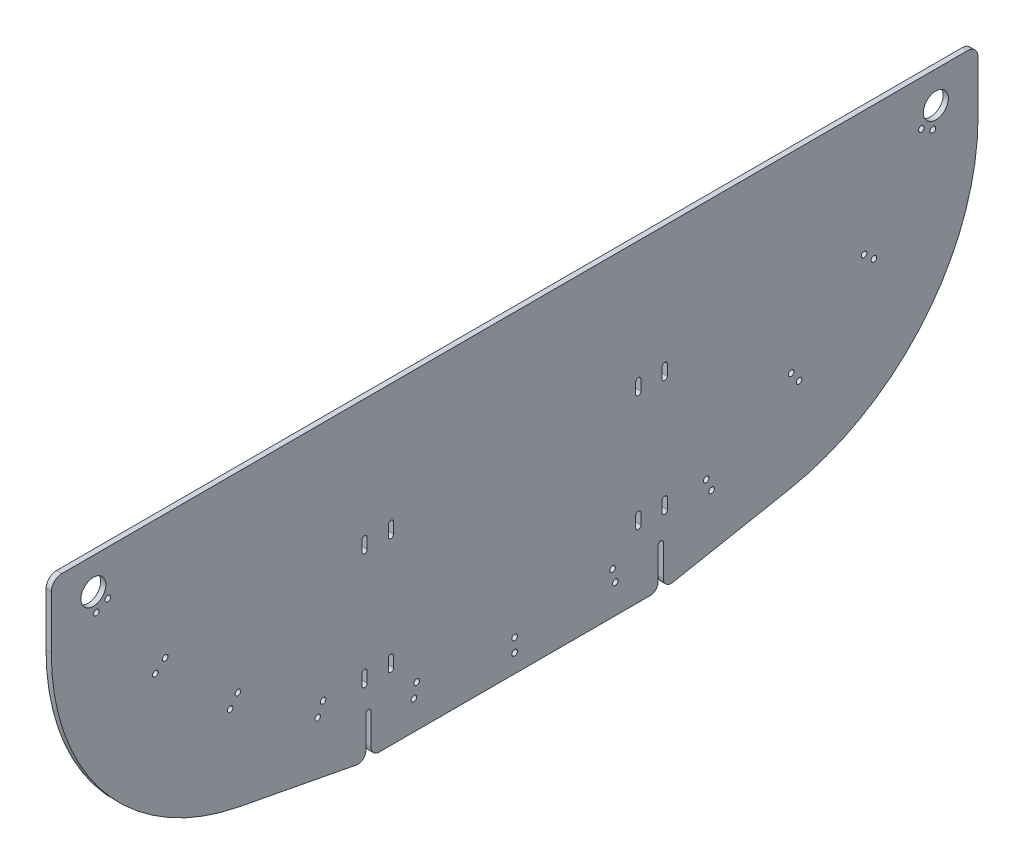
from build123d import *

# Parameters (mm, degrees)
SKETCH1_R                       = 15.08125
BOSS_EXTRUDE1_DEPTH             = 6.35
SKETCH4_R                       = 3.3655
CUT_EXTRUDE1_DEPTH              = 885.657788357
CIRPATTERN1_COUNT               = 6
CIRPATTERN1_ANGLE               = 60.5
CIRPATTERN1_THE_OTHER_WAY_COUNT = 6
CIRPATTERN1_THE_OTHER_WAY_ANGLE = 60.5
F_1_4_0_25_DIAMETER_SLOT1_DEPTH = 6.35
CUT_EXTRUDE2_DEPTH              = 885.657788357
FILLET2_R                       = 9.525
FILLET3_R                       = 12.7
SKETCH9_W                       = 6.35
SKETCH9_H                       = 346.075
CUT_EXTRUDE3_DEPTH              = 3.175
FILLET4_R                       = 9.525


# Read off the part's stored shape, not the designer's step: 1/4 (0.25) Diameter Slot1
with BuildPart() as part:
    # Sketch1 → Boss-Extrude1 (new body)
    with BuildSketch(Plane(origin=(0, 0, 0), x_dir=(0, 0, -1), z_dir=(1, 0, 0))):
        with BuildLine():
            Line((-558.8, 609.6), (-558.8, 685.8))
            Line((-558.8, 685.8), (558.8, 685.8))
            Line((558.8, 685.8), (558.8, 609.6))
            ThreePointArc((558.8, 609.6), (494.720400534, 431.550891286), (331.874551798, 335.171901195))
            Line((331.874551798, 335.171901195), (173.0375, 304.8))
            Line((173.0375, 304.8), (-173.0375, 304.8))
            Line((-173.0375, 304.8), (-331.874551798, 335.171901195))
            ThreePointArc((-331.874551798, 335.171901195), (-494.720400534, 431.550891286), (-558.8, 609.6))
        make_face()
        with Locations((-508, 647.7)):
            Circle(SKETCH1_R, mode=Mode.SUBTRACT)
        with Locations((508, 647.7)):
            Circle(SKETCH1_R, mode=Mode.SUBTRACT)
    extrude(amount=BOSS_EXTRUDE1_DEPTH)

    # Sketch4 → Cut-Extrude1 (cut, through all)
    with BuildSketch(Plane(origin=(6.35, 0, 0), x_dir=(0, 0, -1), z_dir=(1, 0, 0))):
        with Locations((0, 345.954707227)):
            Circle(SKETCH4_R)
        with Locations((0, 330.079707227)):
            Circle(SKETCH4_R)
    cut_extrude1 = extrude(amount=-CUT_EXTRUDE1_DEPTH, mode=Mode.SUBTRACT)

    # CirPattern1: Cut-Extrude1 ×6 about axis
    cirpattern1_axis = Axis((0, 909.517207227, 0), (1, 0, 0))
    for i in range(1, CIRPATTERN1_COUNT):
        add(cut_extrude1.rotate(cirpattern1_axis, i * CIRPATTERN1_ANGLE / (CIRPATTERN1_COUNT - 1)), mode=Mode.SUBTRACT)

    # CirPattern1 the other way: Cut-Extrude1 ×6 about axis
    cirpattern1_the_other_way_axis = Axis((0, 909.517207227, 0), (-1, 0, 0))
    for i in range(1, CIRPATTERN1_THE_OTHER_WAY_COUNT):
        add(cut_extrude1.rotate(cirpattern1_the_other_way_axis, i * CIRPATTERN1_THE_OTHER_WAY_ANGLE / (CIRPATTERN1_THE_OTHER_WAY_COUNT - 1)), mode=Mode.SUBTRACT)

    # 1/4 (0.25) Diameter Slot1 outline → 1/4 (0.25) Diameter Slot1 (cut)
    with BuildSketch(Plane.YZ):
        with BuildLine():
            Line((539.75, 152.4), (527.05, 152.4))
            ThreePointArc((527.05, 152.4), (523.875, 149.225), (527.05, 146.05))
            Line((527.05, 146.05), (539.75, 146.05))
            ThreePointArc((539.75, 146.05), (542.925, 149.225), (539.75, 152.4))
        make_face()
        with BuildLine():
            ThreePointArc((387.35, 152.4), (384.175, 149.225), (387.35, 146.05))
            Line((387.35, 146.05), (400.05, 146.05))
            ThreePointArc((400.05, 146.05), (403.225, 149.225), (400.05, 152.4))
            Line((400.05, 152.4), (387.35, 152.4))
        make_face()
        with BuildLine():
            Line((539.75, 184.15), (527.05, 184.15))
            ThreePointArc((527.05, 184.15), (523.875, 180.975), (527.05, 177.8))
            Line((527.05, 177.8), (539.75, 177.8))
            ThreePointArc((539.75, 177.8), (542.925, 180.975), (539.75, 184.15))
        make_face()
        with BuildLine():
            ThreePointArc((387.35, 184.15), (384.175, 180.975), (387.35, 177.8))
            Line((387.35, 177.8), (400.05, 177.8))
            ThreePointArc((400.05, 177.8), (403.225, 180.975), (400.05, 184.15))
            Line((400.05, 184.15), (387.35, 184.15))
        make_face()
    f_1_4_0_25_diameter_slot1 = extrude(amount=F_1_4_0_25_DIAMETER_SLOT1_DEPTH, mode=Mode.SUBTRACT)

    # Mirror1: 1/4 (0.25) Diameter Slot1 across plane
    add(f_1_4_0_25_diameter_slot1.mirror(Plane.XY), mode=Mode.SUBTRACT)

    # Sketch7 → Cut-Extrude2 (cut, through all)
    with BuildSketch(Plane(origin=(6.35, 0, 0), x_dir=(0, 0, -1), z_dir=(1, 0, 0))):
        with BuildLine():
            Line((-179.3875, 254), (-179.3875, 355.6))
            ThreePointArc((-179.3875, 355.6), (-176.2125, 358.775), (-173.0375, 355.6))
            Line((-173.0375, 355.6), (-173.0375, 254))
            ThreePointArc((-173.0375, 254), (-176.2125, 250.825), (-179.3875, 254))
        make_face()
    cut_extrude2 = extrude(amount=-CUT_EXTRUDE2_DEPTH, mode=Mode.SUBTRACT)

    # Mirror5: Cut-Extrude2 across plane
    add(cut_extrude2.mirror(Plane.XY), mode=Mode.SUBTRACT)

    # Fillet2
    fillet2_edges = [part.edges().sort_by_distance(p)[0] for p in [
        (3.175, 306.014210226, 179.3875),
        (3.175, 306.014210226, -179.3875),
    ]]
    fillet(fillet2_edges, radius=FILLET2_R)

    # Fillet3
    fillet3_edges = [part.edges().sort_by_distance(p)[0] for p in [
        (3.175, 685.8, 558.8),
        (3.175, 685.8, -558.8),
    ]]
    fillet(fillet3_edges, radius=FILLET3_R)

    # Sketch9 → Cut-Extrude3 (cut)
    with BuildSketch(Plane.XZ.offset(-304.8)):
        with Locations((3.175, 0)):
            Rectangle(SKETCH9_W, SKETCH9_H)
    extrude(amount=-CUT_EXTRUDE3_DEPTH, mode=Mode.SUBTRACT)

    # Fillet4
    fillet4_edges = [part.edges().sort_by_distance(p)[0] for p in [
        (3.175, 307.975, 173.0375),
        (3.175, 307.975, -173.0375),
    ]]
    fillet(fillet4_edges, radius=FILLET4_R)


solid = part.part
